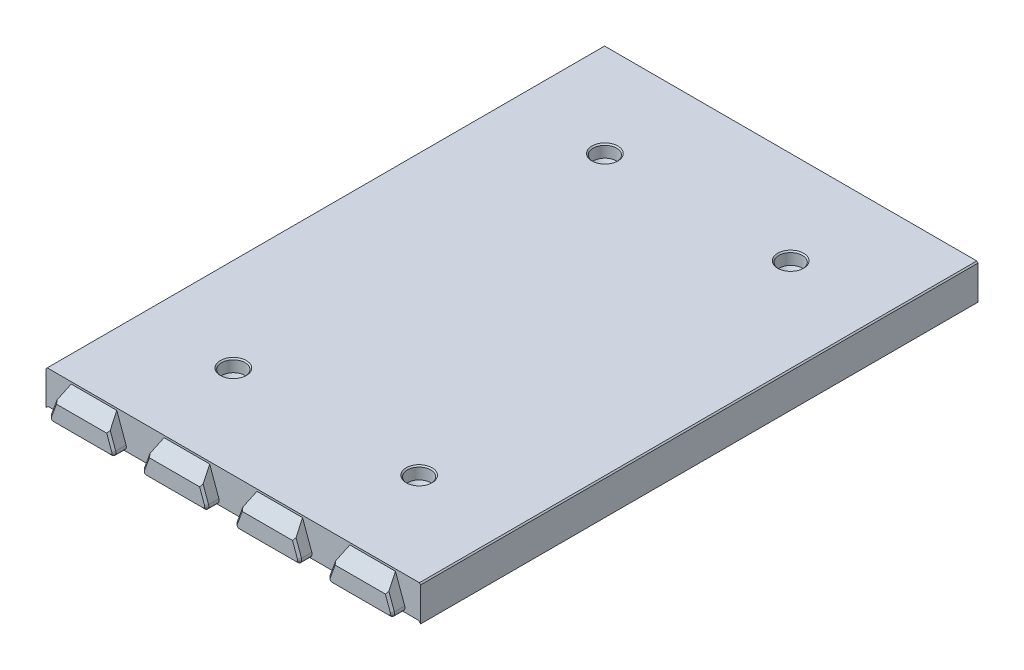
from build123d import *

# Parameters (mm, degrees)
BOSS_EXTRUDE1_DEPTH             = 67.5
SKETCH7_W                       = 86.75
SKETCH7_H                       = 6
BOSS_EXTRUDE7_DEPTH             = 1
BOSS_EXTRUDE4_DEPTH             = 3
BOSS_EXTRUDE8_REACH             = 83.726
BOSS_EXTRUDE8_DIRECTION_2_DEPTH = 2
CHAMFER4_SIZE                   = 0.5
FILLET4_R                       = 1
CHAMFER6_SIZE                   = 0.5
FILLET2_R                       = 2
CHAMFER4_OF_MIRROR2_SIZE        = 0.5
FILLET4_OF_MIRROR2_R            = 1
CHAMFER6_OF_MIRROR2_SIZE        = 0.5
FILLET2_OF_MIRROR2_R            = 2
BOSS_EXTRUDE9_REACH             = 147.488
SKETCH9_R                       = 5
FILLET3_R                       = 3
SKETCH10_R                      = 1.85
CUT_EXTRUDE2_DEPTH              = 146.488455298
SKETCH11_R                      = 2.85
CUT_EXTRUDE3_DEPTH              = 3
CHAMFER7_SIZE                   = 1
CUT_EXTRUDE4_DEPTH              = 146.488455298
CUT_EXTRUDE4_DEPTH_BACK         = 146.488455298
BOSS_EXTRUDE10_DEPTH            = 135
CHAMFER8_SIZE                   = 0.3


with BuildPart() as part:
    # Sketch1 → Boss-Extrude1 (new body)
    with BuildSketch(Plane.XY):
        Polygon((-45.375, 0), (-45.375, 8), (45.375, 8), (45.375, 0), (43.375, 0), (43.375, 6), (-43.375, 6), (-43.375, 0), align=None)
    boss_extrude1 = extrude(amount=-BOSS_EXTRUDE1_DEPTH)

    # Sketch7 → Boss-Extrude7 (add)
    with BuildSketch(Plane.XY):
        with Locations((0, 3)):
            Rectangle(SKETCH7_W, SKETCH7_H)
    boss_extrude7 = extrude(amount=-BOSS_EXTRUDE7_DEPTH)

    # Sketch2 → Boss-Extrude4 (add)
    with BuildSketch(Plane.XY):
        Polygon((28.411761874, 8), (25.5, 0), (42, 0), (39.088238126, 8), align=None)
        Polygon((5.911761874, 8), (3, 0), (19.5, 0), (16.588238126, 8), align=None)
        Polygon((-16.588238126, 8), (-19.5, 0), (-3, 0), (-5.911761874, 8), align=None)
        Polygon((-39.088238126, 8), (-42, 0), (-25.5, 0), (-28.411761874, 8), align=None)
    boss_extrude4 = extrude(amount=BOSS_EXTRUDE4_DEPTH)

    # Sketch8 → Boss-Extrude8 (add, up to next)
    with BuildSketch(Plane.XZ, mode=Mode.PRIVATE) as boss_extrude8_sk1:
        Polygon((-44, -24.955880937), (-44, -20.044119063), (-40, -21.5), (-40, -23.5), align=None)
    boss_extrude8_tool1 = extrude(boss_extrude8_sk1.sketch, amount=-BOSS_EXTRUDE8_REACH, mode=Mode.PRIVATE) - part.part
    # Sketch8 → Boss-Extrude8 (add, up to next)
    with BuildSketch(Plane.XZ, mode=Mode.PRIVATE) as boss_extrude8_sk2:
        Polygon((-44, -67.5), (-44, -65.044119063), (-40, -66.5), (-40, -67.5), align=None)
    boss_extrude8_tool2 = extrude(boss_extrude8_sk2.sketch, amount=-BOSS_EXTRUDE8_REACH, mode=Mode.PRIVATE) - part.part
    # Sketch8 → Boss-Extrude8 (add, up to next)
    with BuildSketch(Plane.XZ, mode=Mode.PRIVATE) as boss_extrude8_sk3:
        Polygon((44, -24.955880937), (40, -23.5), (40, -21.5), (44, -20.044119063), align=None)
    boss_extrude8_tool3 = extrude(boss_extrude8_sk3.sketch, amount=-BOSS_EXTRUDE8_REACH, mode=Mode.PRIVATE) - part.part
    # Sketch8 → Boss-Extrude8 (add, up to next)
    with BuildSketch(Plane.XZ, mode=Mode.PRIVATE) as boss_extrude8_sk4:
        Polygon((40, -67.5), (44, -67.5), (44, -65.044119063), (40, -66.5), align=None)
    boss_extrude8_tool4 = extrude(boss_extrude8_sk4.sketch, amount=-BOSS_EXTRUDE8_REACH, mode=Mode.PRIVATE) - part.part
    boss_extrude8_1 = boss_extrude8_tool1.solids().sort_by_distance((-42.280851, 0, -22.5))[0]
    add(boss_extrude8_1)
    boss_extrude8_2 = boss_extrude8_tool2.solids().sort_by_distance((-42.280851, 0, -66.584919))[0]
    add(boss_extrude8_2)
    boss_extrude8_3 = boss_extrude8_tool3.solids().sort_by_distance((42.280851, 0, -22.5))[0]
    add(boss_extrude8_3)
    boss_extrude8_4 = boss_extrude8_tool4.solids().sort_by_distance((42.280851, 0, -66.584919))[0]
    add(boss_extrude8_4)
    boss_extrude8 = boss_extrude8_1 + boss_extrude8_2 + boss_extrude8_3 + boss_extrude8_4  # Boss-Extrude8 as one shape, for the pattern or mirror that repeats it

    # Sketch8 → Boss-Extrude8 direction 2 (add)
    with BuildSketch(Plane.XZ):
        Polygon((-44, -24.955880937), (-44, -20.044119063), (-40, -21.5), (-40, -23.5), align=None)
        Polygon((-44, -67.5), (-44, -65.044119063), (-40, -66.5), (-40, -67.5), align=None)
        Polygon((44, -24.955880937), (40, -23.5), (40, -21.5), (44, -20.044119063), align=None)
        Polygon((40, -67.5), (44, -67.5), (44, -65.044119063), (40, -66.5), align=None)
    boss_extrude8_direction_2 = extrude(amount=BOSS_EXTRUDE8_DIRECTION_2_DEPTH)

    # Chamfer4
    chamfer4_edges = [part.edges().sort_by_distance(p)[0] for p in [
        (-40, -2, -67),
        (-42, -2, -65.772059531),
        (-44, -2, -66.272059531),
        (-42, -2, -20.772059531),
        (-44, -2, -22.5),
        (-42, -2, -24.227940469),
        (-40, -2, -22.5),
        (44, -2, -22.5),
        (42, -2, -20.772059531),
        (40, -2, -22.5),
        (42, -2, -24.227940469),
        (40, -2, -67),
        (44, -2, -66.272059531),
        (42, -2, -65.772059531),
    ]]
    chamfer(chamfer4_edges, length=CHAMFER4_SIZE)

    # Fillet4
    fillet4_edges = [part.edges().sort_by_distance(p)[0] for p in [
        (25.5, 0, 1.5),
        (42, 0, 1.5),
        (3, 0, 1.5),
        (19.5, 0, 1.5),
        (-19.5, 0, 1.5),
        (-3, 0, 1.5),
        (-42, 0, 1.5),
        (-25.5, 0, 1.5),
    ]]
    fillet(fillet4_edges, radius=FILLET4_R)

    # Chamfer6
    chamfer6_edges = [part.edges().sort_by_distance(p)[0] for p in [
        (40.29989137, 4.671010072, 3),
        (33.75, 0, 3),
        (11.25, 0, 3),
        (-11.25, 0, 3),
        (-33.75, 0, 3),
        (26.108995962, 0.426423564, 3),
        (41.391004038, 0.426423564, 3),
        (17.79989137, 4.671010072, 3),
        (3.608995962, 0.426423564, 3),
        (18.891004038, 0.426423564, 3),
        (-4.70010863, 4.671010072, 3),
        (-18.891004038, 0.426423564, 3),
        (-3.608995962, 0.426423564, 3),
        (-27.20010863, 4.671010072, 3),
        (-41.391004038, 0.426423564, 3),
        (-26.108995962, 0.426423564, 3),
        (27.20010863, 4.671010072, 3),
        (4.70010863, 4.671010072, 3),
        (-17.79989137, 4.671010072, 3),
        (-40.29989137, 4.671010072, 3),
    ]]
    chamfer(chamfer6_edges, length=CHAMFER6_SIZE)

    # Fillet2
    fillet2_edges = [part.edges().sort_by_distance(p)[0] for p in [
        (-43.375, 6, -45),
        (-43.375, 3, -65.271600459),
        (-40, 6, -67),
        (-41.6875, 6, -65.88580023),
        (-43.375, 6, -10.63580023),
        (-43.375, 3, -20.271600459),
        (-43.375, 3, -24.728399541),
        (-41.6875, 6, -20.88580023),
        (-40, 6, -22.5),
        (-41.6875, 6, -24.11419977),
        (43.375, 6, -10.63580023),
        (43.375, 3, -20.271600459),
        (43.375, 3, -24.728399541),
        (41.6875, 6, -20.88580023),
        (41.6875, 6, -24.11419977),
        (40, 6, -22.5),
        (43.375, 6, -45),
        (43.375, 3, -65.271600459),
        (40, 6, -67),
        (41.6875, 6, -65.88580023),
        (-43.375, 3, -1),
        (0, 6, -1),
        (43.375, 3, -1),
    ]]
    fillet(fillet2_edges, radius=FILLET2_R)


with BuildPart() as mirror2_1:
    # Mirror2: Boss-Extrude1, Boss-Extrude7, Boss-Extrude4, Boss-Extrude8, Boss-Extrude8 direction 2 across plane
    add(boss_extrude1.mirror(Plane.XY.offset(-67.5)))
    add(boss_extrude7.mirror(Plane.XY.offset(-67.5)))
    add(boss_extrude4.mirror(Plane.XY.offset(-67.5)))
    add(boss_extrude8.mirror(Plane.XY.offset(-67.5)))
    add(boss_extrude8_direction_2.mirror(Plane.XY.offset(-67.5)))

    # Chamfer4 of Mirror2
    chamfer4_of_mirror2_edges = [mirror2_1.edges().sort_by_distance(p)[0] for p in [
        (-40, -2, -68),
        (-42, -2, -69.227940469),
        (-44, -2, -68.727940469),
        (-42, -2, -114.227940469),
        (-44, -2, -112.5),
        (-42, -2, -110.772059531),
        (-40, -2, -112.5),
        (44, -2, -112.5),
        (42, -2, -114.227940469),
        (40, -2, -112.5),
        (42, -2, -110.772059531),
        (40, -2, -68),
        (44, -2, -68.727940469),
        (42, -2, -69.227940469),
    ]]
    chamfer(chamfer4_of_mirror2_edges, length=CHAMFER4_OF_MIRROR2_SIZE)

    # Fillet4 of Mirror2
    fillet4_of_mirror2_edges = [mirror2_1.edges().sort_by_distance(p)[0] for p in [
        (25.5, 0, -136.5),
        (42, 0, -136.5),
        (3, 0, -136.5),
        (19.5, 0, -136.5),
        (-19.5, 0, -136.5),
        (-3, 0, -136.5),
        (-42, 0, -136.5),
        (-25.5, 0, -136.5),
    ]]
    fillet(fillet4_of_mirror2_edges, radius=FILLET4_OF_MIRROR2_R)

    # Chamfer6 of Mirror2
    chamfer6_of_mirror2_edges = [mirror2_1.edges().sort_by_distance(p)[0] for p in [
        (40.29989137, 4.671010072, -138),
        (33.75, 0, -138),
        (11.25, 0, -138),
        (-11.25, 0, -138),
        (-33.75, 0, -138),
        (26.108995962, 0.426423564, -138),
        (41.391004038, 0.426423564, -138),
        (17.79989137, 4.671010072, -138),
        (3.608995962, 0.426423564, -138),
        (18.891004038, 0.426423564, -138),
        (-4.70010863, 4.671010072, -138),
        (-18.891004038, 0.426423564, -138),
        (-3.608995962, 0.426423564, -138),
        (-27.20010863, 4.671010072, -138),
        (-41.391004038, 0.426423564, -138),
        (-26.108995962, 0.426423564, -138),
        (27.20010863, 4.671010072, -138),
        (4.70010863, 4.671010072, -138),
        (-17.79989137, 4.671010072, -138),
        (-40.29989137, 4.671010072, -138),
    ]]
    chamfer(chamfer6_of_mirror2_edges, length=CHAMFER6_OF_MIRROR2_SIZE)

    # Fillet2 of Mirror2
    fillet2_of_mirror2_edges = [mirror2_1.edges().sort_by_distance(p)[0] for p in [
        (-43.375, 6, -90),
        (-43.375, 3, -69.728399541),
        (-40, 6, -68),
        (-41.6875, 6, -69.11419977),
        (-43.375, 6, -124.36419977),
        (-43.375, 3, -114.728399541),
        (-43.375, 3, -110.271600459),
        (-41.6875, 6, -114.11419977),
        (-40, 6, -112.5),
        (-41.6875, 6, -110.88580023),
        (43.375, 6, -124.36419977),
        (43.375, 3, -114.728399541),
        (43.375, 3, -110.271600459),
        (41.6875, 6, -114.11419977),
        (41.6875, 6, -110.88580023),
        (40, 6, -112.5),
        (43.375, 6, -90),
        (43.375, 3, -69.728399541),
        (40, 6, -68),
        (41.6875, 6, -69.11419977),
        (-43.375, 3, -134),
        (0, 6, -134),
        (43.375, 3, -134),
    ]]
    fillet(fillet2_of_mirror2_edges, radius=FILLET2_OF_MIRROR2_R)


with BuildPart() as part_1:
    add(part.part)

    # Mirror2 united with what the copies touc: union Mirror2_1
    add(mirror2_1.part)

    # Sketch9 → Boss-Extrude9 (add, up to next)
    with BuildSketch(Plane(origin=(0, 0, 0), x_dir=(1, 0, 0), z_dir=(0, 1, 0)), mode=Mode.PRIVATE) as boss_extrude9_sk1:
        with Locations(Location((-22.5, 22.5, 0), (0, 0, 90))):
            Circle(SKETCH9_R)
    boss_extrude9_tool1 = extrude(boss_extrude9_sk1.sketch, amount=BOSS_EXTRUDE9_REACH, mode=Mode.PRIVATE) - part_1.part
    # Sketch9 → Boss-Extrude9 (add, up to next)
    with BuildSketch(Plane(origin=(0, 0, 0), x_dir=(1, 0, 0), z_dir=(0, 1, 0)), mode=Mode.PRIVATE) as boss_extrude9_sk2:
        with Locations(Location((22.5, 22.5, 0), (0, 0, 90))):
            Circle(SKETCH9_R)
    boss_extrude9_tool2 = extrude(boss_extrude9_sk2.sketch, amount=BOSS_EXTRUDE9_REACH, mode=Mode.PRIVATE) - part_1.part
    # Sketch9 → Boss-Extrude9 (add, up to next)
    with BuildSketch(Plane(origin=(0, 0, 0), x_dir=(1, 0, 0), z_dir=(0, 1, 0)), mode=Mode.PRIVATE) as boss_extrude9_sk3:
        with Locations(Location((22.5, 112.5, 0), (0, 0, 90))):
            Circle(SKETCH9_R)
    boss_extrude9_tool3 = extrude(boss_extrude9_sk3.sketch, amount=BOSS_EXTRUDE9_REACH, mode=Mode.PRIVATE) - part_1.part
    # Sketch9 → Boss-Extrude9 (add, up to next)
    with BuildSketch(Plane(origin=(0, 0, 0), x_dir=(1, 0, 0), z_dir=(0, 1, 0)), mode=Mode.PRIVATE) as boss_extrude9_sk4:
        with Locations(Location((-22.5, 112.5, 0), (0, 0, 90))):
            Circle(SKETCH9_R)
    boss_extrude9_tool4 = extrude(boss_extrude9_sk4.sketch, amount=BOSS_EXTRUDE9_REACH, mode=Mode.PRIVATE) - part_1.part
    add(boss_extrude9_tool1.solids().sort_by_distance((-22.5, 0, -22.5))[0])
    add(boss_extrude9_tool2.solids().sort_by_distance((22.5, 0, -22.5))[0])
    add(boss_extrude9_tool3.solids().sort_by_distance((22.5, 0, -112.5))[0])
    add(boss_extrude9_tool4.solids().sort_by_distance((-22.5, 0, -112.5))[0])

    # Fillet3
    fillet3_edges = [part_1.edges().sort_by_distance(p)[0] for p in [
        (-22.5, 6, -107.5),
        (22.5, 6, -107.5),
        (22.5, 6, -17.5),
        (-22.5, 6, -17.5),
    ]]
    fillet(fillet3_edges, radius=FILLET3_R)

    # Sketch10 → Cut-Extrude2 (cut, through all)
    with BuildSketch(Plane(origin=(0, 0, 0), x_dir=(1, 0, 0), z_dir=(0, 1, 0))):
        with Locations(Location((-22.5, 112.5, 0), (0, 0, 270))):
            Circle(SKETCH10_R)
        with Locations(Location((-22.5, 22.5, 0), (0, 0, 270))):
            Circle(SKETCH10_R)
        with Locations(Location((22.5, 22.5, 0), (0, 0, 270))):
            Circle(SKETCH10_R)
        with Locations(Location((22.5, 112.5, 0), (0, 0, 270))):
            Circle(SKETCH10_R)
    extrude(amount=CUT_EXTRUDE2_DEPTH, mode=Mode.SUBTRACT)

    # Sketch11 → Cut-Extrude3 (cut)
    with BuildSketch(Plane(origin=(0, 8, 0), x_dir=(1, 0, 0), z_dir=(0, 1, 0))):
        with Locations(Location((-22.5, 112.5, 0), (0, 0, 270))):
            Circle(SKETCH11_R)
        with Locations(Location((22.5, 112.5, 0), (0, 0, 270))):
            Circle(SKETCH11_R)
        with Locations(Location((22.5, 22.5, 0), (0, 0, 270))):
            Circle(SKETCH11_R)
        with Locations(Location((-22.5, 22.5, 0), (0, 0, 270))):
            Circle(SKETCH11_R)
    extrude(amount=-CUT_EXTRUDE3_DEPTH, mode=Mode.SUBTRACT)

    # Chamfer7
    chamfer7_edges = [part_1.edges().sort_by_distance(p)[0] for p in [
        (-22.5, 5, -24.35),
        (22.5, 5, -24.35),
        (22.5, 5, -114.35),
        (-22.5, 5, -114.35),
    ]]
    chamfer(chamfer7_edges, length=CHAMFER7_SIZE - 0.0001)  # a hair under: the kernel refuses the full size

    # Sketch12 → Cut-Extrude4 (cut, two sides: drawn at the far end of the back side and taken through both)
    with BuildSketch(Plane(origin=(0, 0, 0), x_dir=(0, 0, -1), z_dir=(1, 0, 0)).offset(-CUT_EXTRUDE4_DEPTH_BACK)):
        Polygon((0, 7.5), (-3, 4.5), (-3, 7.5), (-3, 8), (0, 8), align=None)
        Polygon((138, 4.5), (138, 7.5), (138, 8), (135, 8), (135, 7.5), align=None)
    extrude(amount=CUT_EXTRUDE4_DEPTH + CUT_EXTRUDE4_DEPTH_BACK, mode=Mode.SUBTRACT)

    # Sketch13 → Boss-Extrude10 (add)
    with BuildSketch(Plane(origin=(0, 0, -135), x_dir=(-1, 0, 0), z_dir=(0, 0, -1))):
        Polygon((-44.875, 0), (-45.375, -0.5), (-45.375, 0), align=None)
        Polygon((45.375, 0), (44.875, 0), (45.375, -0.5), align=None)
    extrude(amount=-BOSS_EXTRUDE10_DEPTH)

    # Chamfer8
    chamfer8_edges = [part_1.edges().sort_by_distance(p)[0] for p in [
        (-45.375, 8, -67.5),
        (45.375, 8, -67.5),
        (-22.5, 8, -25.35),
        (22.5, 8, -25.35),
        (22.5, 8, -115.35),
        (-22.5, 8, -115.35),
    ]]
    chamfer(chamfer8_edges, length=CHAMFER8_SIZE)


solid = part_1.part
